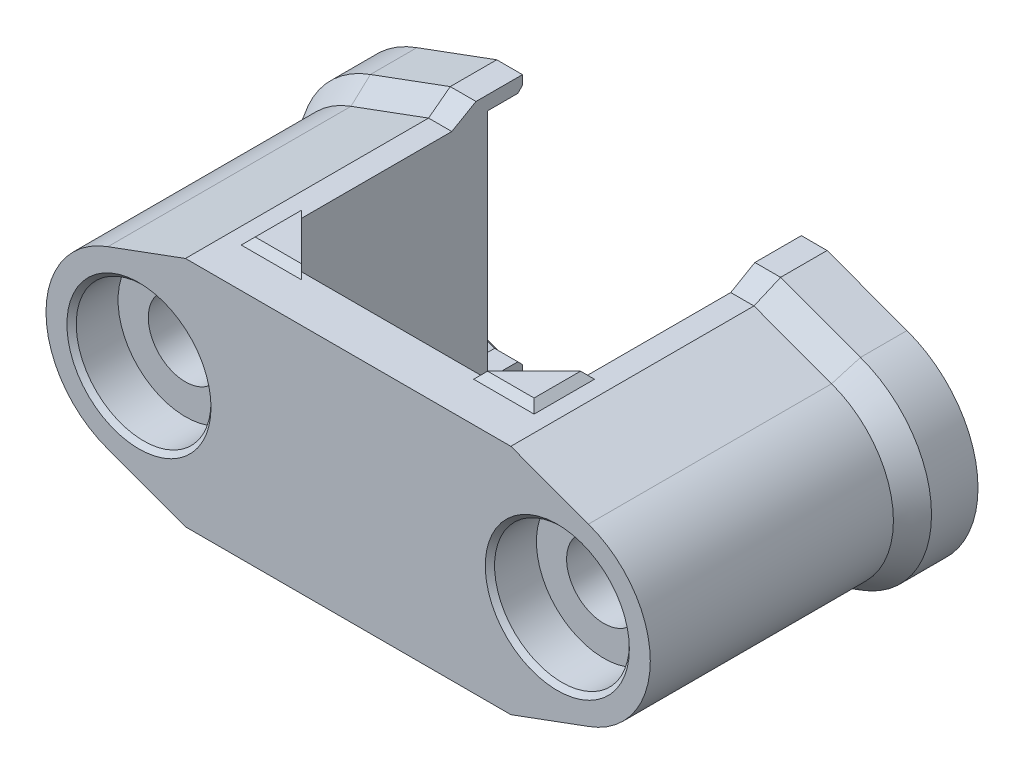
from build123d import *
from OCP.BRepFilletAPI import BRepFilletAPI_MakeChamfer

# Parameters (mm, degrees)
SKIZZE2_R                            = 1.6
AUFSATZ_LINEAR_AUSTRAGEN1_DEPTH      = 12
SCHNITT_LINEAR_AUSTRAGEN1_DEPTH      = 19.384776311
SCHNITT_LINEAR_AUSTRAGEN1_DEPTH_BACK = 19.384776311
SKIZZE3_W                            = 12
SKIZZE3_H                            = 10
AUFSATZ_LINEAR_AUSTRAGEN2_DEPTH      = 12
AUFSATZ_LINEAR_START                 = -0.4
AUFSATZ_LINEAR_AUSTRAGEN3_DEPTH      = 0.7
FASE3_SIZE                           = 0.3
AUFSATZ_LINEAR_AUSTRAGEN4_DEPTH      = 2
FASE1_SIZE                           = 0.6
FASE1_SIZE_2                         = 1.039230485
SKIZZE7_R                            = 2.9
SCHNITT_LINEAR_AUSTRAGEN2_DEPTH      = 2
FASE2_SIZE                           = 0.2


with BuildPart() as part:
    # Skizze2 → Aufsatz-Linear austragen1 (new body)
    with BuildSketch(Plane.XY):
        with BuildLine():
            Line((-6, -2.645751311), (-6, -5))
            Line((-6, -5), (6, -5))
            Line((6, -5), (6, -2.645751311))
            ThreePointArc((6, -2.645751311), (13, 0), (6, 2.645751311))
            Line((6, 2.645751311), (6, 5))
            Line((6, 5), (-6, 5))
            Line((-6, 5), (-6, 2.645751311))
            ThreePointArc((-6, 2.645751311), (-13, 0), (-6, -2.645751311))
        make_face()
        with Locations((-9, 0)):
            Circle(SKIZZE2_R, mode=Mode.SUBTRACT)
        with Locations(Location((9, 0, 0), (0, 0, 180))):
            Circle(SKIZZE2_R, mode=Mode.SUBTRACT)
    extrude(amount=AUFSATZ_LINEAR_AUSTRAGEN1_DEPTH)

    # Skizze3 → Schnitt-Linear austragen1 (cut, two sides: drawn at the far end of the back side and taken through both)
    with BuildSketch(Plane(origin=(0, 0, 0), x_dir=(-1, 0, 0), z_dir=(0, -1, 0)).offset(-SCHNITT_LINEAR_AUSTRAGEN1_DEPTH_BACK)):
        with Locations((0, -5)):
            Rectangle(SKIZZE3_W, SKIZZE3_H)
    extrude(amount=SCHNITT_LINEAR_AUSTRAGEN1_DEPTH + SCHNITT_LINEAR_AUSTRAGEN1_DEPTH_BACK, mode=Mode.SUBTRACT)

    # Skizze4 → Aufsatz-Linear austragen2 (add, through all)
    with BuildSketch(Plane.XY.offset(12)):
        with BuildLine():
            Line((-6, 2.645751311), (-6, 5))
            Line((-6, 5), (-7, 5))
            Line((-7, 5), (-10.338485005, 3.769410815))
            ThreePointArc((-10.338485005, 3.769410815), (-7.997098863, 3.872233117), (-6, 2.645751311))
        make_face()
        with BuildLine():
            ThreePointArc((-6, -2.645751311), (-7.997098863, -3.872233117), (-10.338485005, -3.769410815))
            Line((-10.338485005, -3.769410815), (-7, -5))
            Line((-7, -5), (-6, -5))
            Line((-6, -5), (-6, -2.645751311))
        make_face()
        with BuildLine():
            ThreePointArc((6, 2.645751311), (7.997098863, 3.872233117), (10.338485005, 3.769410815))
            Line((10.338485005, 3.769410815), (7, 5))
            Line((7, 5), (6, 5))
            Line((6, 5), (6, 2.645751311))
        make_face()
        with BuildLine():
            Line((6, -2.645751311), (6, -5))
            Line((6, -5), (7, -5))
            Line((7, -5), (10.338485005, -3.769410815))
            ThreePointArc((10.338485005, -3.769410815), (7.997098863, -3.872233117), (6, -2.645751311))
        make_face()
    extrude(amount=-AUFSATZ_LINEAR_AUSTRAGEN2_DEPTH)

    # Skizze5 → Aufsatz-Linear austragen3 (add)
    with BuildSketch(Plane.XZ.offset(5).offset(AUFSATZ_LINEAR_START)):
        Polygon((-6, 10), (-4, 10), (-6, 8), align=None)
        Polygon((6, 8), (6, 10), (4, 10), align=None)
    aufsatz_linear_austragen3 = extrude(amount=AUFSATZ_LINEAR_AUSTRAGEN3_DEPTH)

    # Spiegeln1: Aufsatz-Linear austragen3 across plane
    add(aufsatz_linear_austragen3.mirror(Plane(origin=(0, 0, 0), x_dir=(0, 0, 1), z_dir=(0, -1, 0))))

    # Fase3
    fase3_edges = [part.edges().sort_by_distance(p)[0] for p in [
        (6, -5, 9),
        (5, -5, 10),
        (-6, -5, 9),
        (-5, -5, 10),
        (6, 5, 9),
        (5, 5, 10),
        (-5, 5, 10),
        (-6, 5, 9),
    ]]
    chamfer(fase3_edges, length=FASE3_SIZE - 0.0001)  # a hair under: the kernel refuses the full size

    # Skizze6 → Aufsatz-Linear austragen4 (add)
    with BuildSketch(Plane(origin=(0, 0, -1.5), x_dir=(-1, 0, 0), z_dir=(0, 0, -1))):
        with BuildLine():
            Line((6, -5), (7, -5))
            Line((7, -5), (10.338485005, -3.769410815))
            ThreePointArc((10.338485005, -3.769410815), (13, 0), (10.338485005, 3.769410815))
            Line((10.338485005, 3.769410815), (7, 5))
            Line((7, 5), (6, 5))
            Line((6, 5), (6, 5.6))
            Line((6, 5.6), (7.107061274, 5.6))
            Line((7.107061274, 5.6), (10.542753877, 4.333579407))
            ThreePointArc((10.542753877, 4.333579407), (13.6, 0), (10.542753877, -4.333579407))
            Line((10.542753877, -4.333579407), (7.107061274, -5.6))
            Line((7.107061274, -5.6), (6, -5.6))
            Line((6, -5.6), (6, -5))
        make_face()
        with BuildLine():
            Line((-6, -5), (-6, -5.6))
            Line((-6, -5.6), (-7.107061274, -5.6))
            Line((-7.107061274, -5.6), (-10.542753877, -4.333579407))
            ThreePointArc((-10.542753877, -4.333579407), (-13.6, 0), (-10.542753877, 4.333579407))
            Line((-10.542753877, 4.333579407), (-7.107061274, 5.6))
            Line((-7.107061274, 5.6), (-6, 5.6))
            Line((-6, 5.6), (-6, 5))
            Line((-6, 5), (-7, 5))
            Line((-7, 5), (-10.338485005, 3.769410815))
            ThreePointArc((-10.338485005, 3.769410815), (-13, 0), (-10.338485005, -3.769410815))
            Line((-10.338485005, -3.769410815), (-7, -5))
            Line((-7, -5), (-6, -5))
        make_face()
    extrude(amount=-AUFSATZ_LINEAR_AUSTRAGEN4_DEPTH)

    # Fase1
    fase1_edges_1 = [part.edges().sort_by_distance(p)[0] for p in [
        (-6.5, -5, 0.5),
    ]]
    fase1_side_1 = [part.faces().sort_by_distance(p)[0] for p in [
        (-6.5, -5.012, 0.5),
    ]]
    fase1_edges_2 = [part.edges().sort_by_distance(p)[0] for p in [
        (-8.669242502, -4.384705408, 0.5),
    ]]
    fase1_side_2 = [part.faces().sort_by_distance(p)[0] for p in [
        (-8.673392811, -4.395964845, 0.5),
    ]]
    fase1_edges_3 = [part.edges().sort_by_distance(p)[0] for p in [
        (-8.669242502, 4.384705408, 0.5),
    ]]
    fase1_side_3 = [part.faces().sort_by_distance(p)[0] for p in [
        (-8.673392811, 4.395964845, 0.5),
    ]]
    fase1_edges_4 = [part.edges().sort_by_distance(p)[0] for p in [
        (-6.5, 5, 0.5),
    ]]
    fase1_side_4 = [part.faces().sort_by_distance(p)[0] for p in [
        (-6.5, 5, 0.512),
    ]]
    fase1_edges_5 = [part.edges().sort_by_distance(p)[0] for p in [
        (6.5, 5, 0.5),
    ]]
    fase1_side_5 = [part.faces().sort_by_distance(p)[0] for p in [
        (6.5, 5, 0.512),
    ]]
    fase1_edges_6 = [part.edges().sort_by_distance(p)[0] for p in [
        (8.669242502, 4.384705408, 0.5),
    ]]
    fase1_side_6 = [part.faces().sort_by_distance(p)[0] for p in [
        (8.669242502, 4.384705408, 0.512),
    ]]
    fase1_edges_7 = [part.edges().sort_by_distance(p)[0] for p in [
        (8.669242502, -4.384705408, 0.5),
    ]]
    fase1_side_7 = [part.faces().sort_by_distance(p)[0] for p in [
        (8.673392811, -4.395964845, 0.5),
    ]]
    fase1_edges_8 = [part.edges().sort_by_distance(p)[0] for p in [
        (6.5, -5, 0.5),
    ]]
    fase1_side_8 = [part.faces().sort_by_distance(p)[0] for p in [
        (6.5, -5.012, 0.5),
    ]]
    fase1 = BRepFilletAPI_MakeChamfer(part.part.solid().wrapped)
    for e in fase1_edges_1:
        fase1.Add(FASE1_SIZE - 0.0001, FASE1_SIZE_2 - 0.0001, e.wrapped, fase1_side_1[0].wrapped)
    for e in fase1_edges_2:
        fase1.Add(FASE1_SIZE - 0.0001, FASE1_SIZE_2 - 0.0001, e.wrapped, fase1_side_2[0].wrapped)
    for e in fase1_edges_3:
        fase1.Add(FASE1_SIZE - 0.0001, FASE1_SIZE_2 - 0.0001, e.wrapped, fase1_side_3[0].wrapped)
    for e in fase1_edges_4:
        fase1.Add(FASE1_SIZE_2 - 0.0001, FASE1_SIZE - 0.0001, e.wrapped, fase1_side_4[0].wrapped)
    for e in fase1_edges_5:
        fase1.Add(FASE1_SIZE_2 - 0.0001, FASE1_SIZE - 0.0001, e.wrapped, fase1_side_5[0].wrapped)
    for e in fase1_edges_6:
        fase1.Add(FASE1_SIZE_2 - 0.0001, FASE1_SIZE - 0.0001, e.wrapped, fase1_side_6[0].wrapped)
    for e in fase1_edges_7:
        fase1.Add(FASE1_SIZE - 0.0001, FASE1_SIZE_2 - 0.0001, e.wrapped, fase1_side_7[0].wrapped)
    for e in fase1_edges_8:
        fase1.Add(FASE1_SIZE - 0.0001, FASE1_SIZE_2 - 0.0001, e.wrapped, fase1_side_8[0].wrapped)
    add(Compound.cast(fase1.Shape()), mode=Mode.REPLACE)  # a hair under: the kernel refuses the full size

    # Skizze7 → Schnitt-Linear austragen2 (cut)
    with BuildSketch(Plane.XY.offset(12)):
        with Locations((-9, 0)):
            Circle(SKIZZE7_R)
        with Locations((9, 0)):
            Circle(SKIZZE7_R)
    extrude(amount=-SCHNITT_LINEAR_AUSTRAGEN2_DEPTH, mode=Mode.SUBTRACT)

    # Fase2
    fase2_edges = [part.edges().sort_by_distance(p)[0] for p in [
        (-6.5, -5, -1.5),
        (-8.669242502, -4.384705408, -1.5),
        (-8.669242502, 4.384705408, -1.5),
        (-6.5, 5, -1.5),
        (6.5, -5, -1.5),
        (8.669242502, -4.384705408, -1.5),
        (13, 0, -1.5),
        (8.669242502, 4.384705408, -1.5),
        (6.5, 5, -1.5),
        (10.6, 0, 0),
        (-10.6, 0, 0),
        (-11.9, 0, 12),
        (6.1, 0, 12),
    ]]
    chamfer(fase2_edges, length=FASE2_SIZE)


solid = part.part
